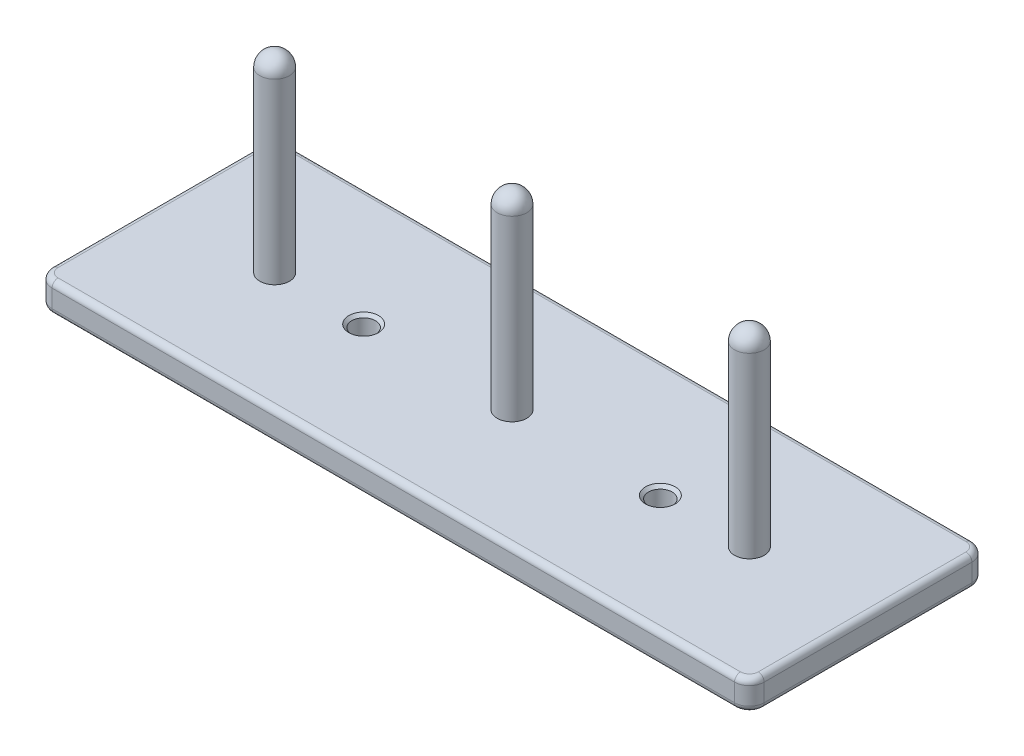
from build123d import *

# Parameters (mm, degrees)
SKETCH_4_W          = 240
SKETCH_4_H          = 80
EXTRUDE_2_DEPTH     = 10
CUT_EXTRUDE_START   = 2
SKETCH_5_W          = 236
SKETCH_5_H          = 76
CUT_EXTRUDE_1_DEPTH = 6
FILLET_2_R          = 5
FILLET_1_R          = 2
SKETCH_6_R          = 5
SKETCH_6_R_2        = 3.5
EXTRUDE_3_DEPTH     = 70
CUT_EXTRUDE_2_REACH = 148.068
CUT_EXTRUDE_START_2 = 1.5
SKETCH_7_R          = 4
SKETCH_8_R          = 5.5
SKETCH_8_R_2        = 4
EXTRUDE_4_DEPTH     = 10
SKETCH_9_R          = 2
CUT_EXTRUDE_3_DEPTH = 10
CHAMFER_1_SIZE      = 1


# Read off the part's stored shape, not the designer's step: 旋转1, 旋转2
with BuildPart() as part:
    # 草图4 → 凸台-拉伸2 (new body)
    with BuildSketch(Plane(origin=(0, 0, 0), x_dir=(1, 0, 0), z_dir=(0, 1, 0))):
        Rectangle(SKETCH_4_W, SKETCH_4_H)
    extrude(amount=EXTRUDE_2_DEPTH)

    # 草图5 → 切除-拉伸1 (cut)
    with BuildSketch(Plane(origin=(0, 0, 0), x_dir=(1, 0, 0), z_dir=(0, 1, 0)).offset(CUT_EXTRUDE_START)):
        Rectangle(SKETCH_5_W, SKETCH_5_H)
    extrude(amount=CUT_EXTRUDE_1_DEPTH, mode=Mode.SUBTRACT)

    # 圆角2
    fillet_2_edges = [part.edges().sort_by_distance(p)[0] for p in [
        (120, 5, 40),
        (-120, 5, 40),
        (-120, 5, -40),
        (120, 5, -40),
    ]]
    fillet(fillet_2_edges, radius=FILLET_2_R)

    # 圆角1
    fillet_1_edges = [part.edges().sort_by_distance(p)[0] for p in [
        (120, 0, 0),
        (120, 10, 0),
        (0, 0, 40),
        (-120, 0, 0),
        (0, 0, -40),
        (118.535533906, 0, -38.535533906),
        (-118.535533906, 0, -38.535533906),
        (-118.535533906, 0, 38.535533906),
        (118.535533906, 0, 38.535533906),
        (0, 10, 40),
        (0, 10, -40),
        (-120, 10, 0),
        (118.535533906, 10, -38.535533906),
        (-118.535533906, 10, -38.535533906),
        (-118.535533906, 10, 38.535533906),
        (118.535533906, 10, 38.535533906),
    ]]
    fillet(fillet_1_edges, radius=FILLET_1_R)

    # 草图6 → 凸台-拉伸3 (add)
    # profile 1 of 3: a face of its own
    with BuildSketch(Plane(origin=(0, 0, 0), x_dir=(1, 0, 0), z_dir=(0, 1, 0))):
        with Locations(Location((-80, 0, 0), (0, 0, 90))):
            Circle(SKETCH_6_R)
        with Locations(Location((-80, 0, 0), (0, 0, 90))):
            Circle(SKETCH_6_R_2, mode=Mode.SUBTRACT)
    # profile 2 of 3: a face of its own
    with BuildSketch(Plane(origin=(0, 0, 0), x_dir=(1, 0, 0), z_dir=(0, 1, 0))):
        with Locations(Location((0, 0, 0), (0, 0, 90))):
            Circle(SKETCH_6_R)
        with Locations(Location((0, 0, 0), (0, 0, 90))):
            Circle(SKETCH_6_R_2, mode=Mode.SUBTRACT)
    # profile 3 of 3: a face of its own
    with BuildSketch(Plane(origin=(0, 0, 0), x_dir=(1, 0, 0), z_dir=(0, 1, 0))):
        with Locations(Location((80, 0, 0), (0, 0, 90))):
            Circle(SKETCH_6_R)
        with Locations(Location((80, 0, 0), (0, 0, 90))):
            Circle(SKETCH_6_R_2, mode=Mode.SUBTRACT)
    extrude(amount=EXTRUDE_3_DEPTH)

    # 切除-拉伸2: up to this face of the body (flat: up to its plane)
    cut_extrude_2_end = Plane(part.part.faces().sort_by_distance((115.520645245, 10, 0))[0])
    # 草图7 → 切除-拉伸2 (cut, up to the picked face)
    with BuildSketch(Plane(origin=(0, 0, 0), x_dir=(1, 0, 0), z_dir=(0, 1, 0)).offset(CUT_EXTRUDE_START_2), mode=Mode.PRIVATE) as cut_extrude_2_sk1:
        with Locations(Location((-50, 0, 0), (0, 0, 90))):
            Circle(SKETCH_7_R)
    cut_extrude_2_tool1 = split(extrude(cut_extrude_2_sk1.sketch, amount=CUT_EXTRUDE_2_REACH, mode=Mode.PRIVATE), bisect_by=cut_extrude_2_end, keep=Keep.BOTH, mode=Mode.PRIVATE)
    # 草图7 → 切除-拉伸2 (cut, up to the picked face)
    with BuildSketch(Plane(origin=(0, 0, 0), x_dir=(1, 0, 0), z_dir=(0, 1, 0)).offset(CUT_EXTRUDE_START_2), mode=Mode.PRIVATE) as cut_extrude_2_sk2:
        with Locations(Location((50, 0, 0), (0, 0, 90))):
            Circle(SKETCH_7_R)
    cut_extrude_2_tool2 = split(extrude(cut_extrude_2_sk2.sketch, amount=CUT_EXTRUDE_2_REACH, mode=Mode.PRIVATE), bisect_by=cut_extrude_2_end, keep=Keep.BOTH, mode=Mode.PRIVATE)
    add(cut_extrude_2_tool1.solids().sort_by(Axis((-50, 1.5, 0), (0, 1, 0)))[0], mode=Mode.SUBTRACT)
    add(cut_extrude_2_tool2.solids().sort_by(Axis((50, 1.5, 0), (0, 1, 0)))[0], mode=Mode.SUBTRACT)

    # 草图8 → 凸台-拉伸4 (add)
    # profile 1 of 2: a face of its own
    with BuildSketch(Plane(origin=(0, 0, 0), x_dir=(1, 0, 0), z_dir=(0, 1, 0))):
        with Locations(Location((-50, 0, 0), (0, 0, 90))):
            Circle(SKETCH_8_R)
        with Locations(Location((-50, 0, 0), (0, 0, 90))):
            Circle(SKETCH_8_R_2, mode=Mode.SUBTRACT)
    # profile 2 of 2: a face of its own
    with BuildSketch(Plane(origin=(0, 0, 0), x_dir=(1, 0, 0), z_dir=(0, 1, 0))):
        with Locations(Location((50, 0, 0), (0, 0, 90))):
            Circle(SKETCH_8_R)
        with Locations(Location((50, 0, 0), (0, 0, 90))):
            Circle(SKETCH_8_R_2, mode=Mode.SUBTRACT)
    extrude(amount=EXTRUDE_4_DEPTH)

    # 草图9 → 切除-拉伸3 (cut)
    with BuildSketch(Plane(origin=(0, 0, 0), x_dir=(1, 0, 0), z_dir=(0, 1, 0))):
        with Locations(Location((-50, 0, 0), (0, 0, 90))):
            Circle(SKETCH_9_R)
        with Locations(Location((50, 0, 0), (0, 0, 90))):
            Circle(SKETCH_9_R)
    extrude(amount=CUT_EXTRUDE_3_DEPTH, mode=Mode.SUBTRACT)

    # 倒角1
    chamfer_1_edges = [part.edges().sort_by_distance(p)[0] for p in [
        (-50, 10, 4),
        (50, 10, 4),
    ]]
    chamfer(chamfer_1_edges, length=CHAMFER_1_SIZE)

    # 旋转1 outline → 旋转1 (revolve)
    with BuildSketch(Plane.XY):
        with BuildLine():
            Line((3.5, 70), (5, 69.999999998))
            ThreePointArc((5, 69.999999998), (3.535533907, 73.535533905), (0, 75))
            Line((0, 75), (0, 73.5))
            ThreePointArc((0, 73.5), (2.474873734, 72.474873734), (3.5, 70))
        make_face()
        with BuildLine():
            ThreePointArc((3.5, 70), (2.474873734, 67.525126266), (0, 66.5))
            Line((0, 66.5), (0, 65))
            ThreePointArc((0, 65), (1.890294811, 65.371092405), (3.500000004, 66.429285789))
            Line((3.500000004, 66.429285789), (3.5, 70))
        make_face()
    revolve(axis=Axis((0, 0, 0), (0, 1, 0)))

    # 旋转2 outline → 旋转2 (revolve)
    with BuildSketch(Plane(origin=(-80, 0, 0), x_dir=(1, 0, 0), z_dir=(0, 0, 1))):
        with BuildLine():
            Line((3.5, 69.999999996), (5, 69.999999996))
            ThreePointArc((5, 69.999999996), (3.535533907, 73.535533905), (0, 75))
            Line((0, 75), (0, 73.5))
            ThreePointArc((0, 73.5), (2.474873735, 72.474873733), (3.5, 69.999999996))
        make_face()
    revolve(axis=Axis((-80, 0, 0), (0, 1, 0)))

    # 草图13 → 旋转3 (revolve)
    with BuildSketch(Plane.XY):
        with BuildLine():
            Line((83.5, 70), (85, 70))
            ThreePointArc((85, 70), (83.535533906, 73.535533906), (80, 75))
            Line((80, 75), (80, 73.5))
            ThreePointArc((80, 73.5), (82.474873734, 72.474873734), (83.5, 70))
        make_face()
    revolve(axis=Axis((80, -930, 0), (0, 1, 0)))


solid = part.part
